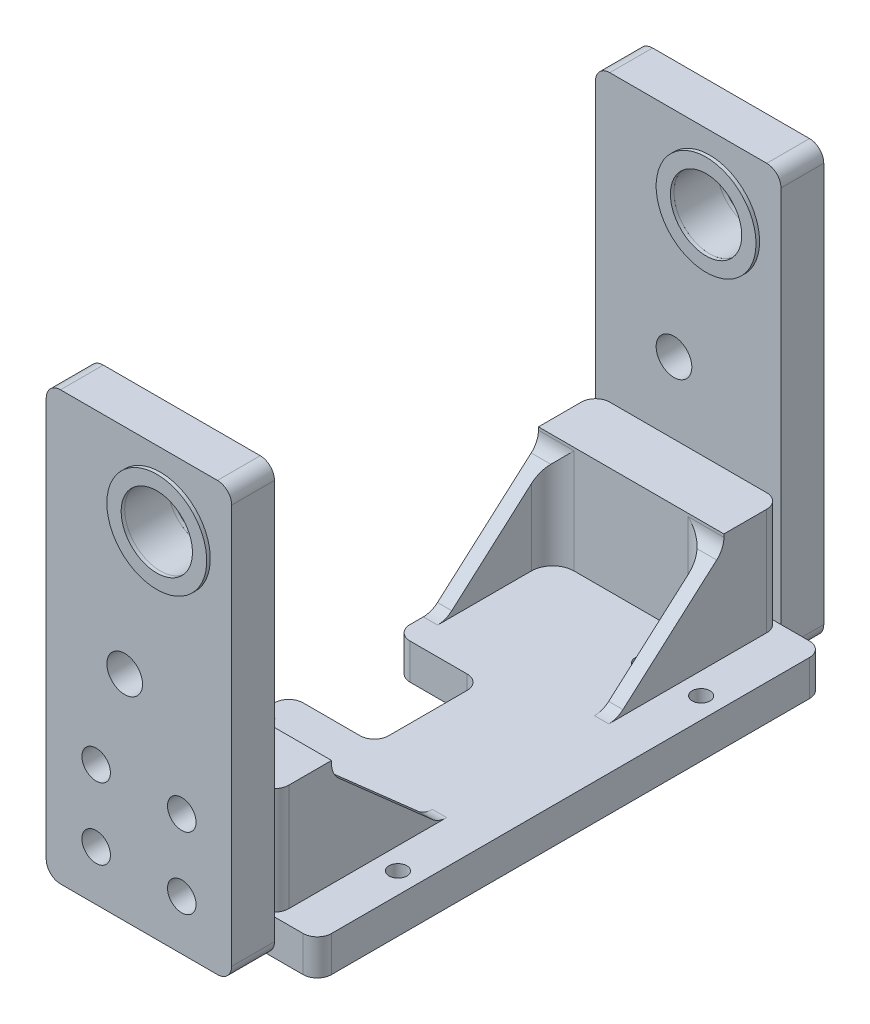
from build123d import *

# Parameters (mm, degrees)
SKETCH_1_W           = 18
SKETCH_1_H           = 21.5
SKETCH_1_R           = 1.25
EXTRUDE_1_DEPTH      = 71
SKETCH_2_W           = 18
SKETCH_2_H           = 59
CUT_EXTRUDE_1_DEPTH  = 42
SKETCH_3_W           = 18
SKETCH_3_H           = 59
EXTRUDE_2_DEPTH      = 7
SKETCH_4_R           = 2.1
CUT_EXTRUDE_2_DEPTH  = 75
SKETCH_5_W           = 12
SKETCH_5_H           = 15
CUT_EXTRUDE_3_DEPTH  = 12
SKETCH_6_R           = 1.65
CUT_EXTRUDE_4_DEPTH  = 10
FILLET_2_R           = 2
FILLET_4_R           = 2
EXTRUDE_3_DEPTH      = 8
SKETCH_9_R           = 1.65
EXTRUDE_4_DEPTH      = 7
SKETCH_10_R          = 1.65
CUT_EXTRUDE_5_DEPTH  = 10
FILLET_5_R           = 2
SKETCH_11_R          = 1.65
EXTRUDE_5_DEPTH      = 20
CUT_EXTRUDE_6_DEPTH  = 22
SKETCH_14_R          = 1.25
SKETCH_14_R_2        = 2.1
EXTRUDE_6_DEPTH      = 6
SKETCH_15_R          = 1.25
SKETCH_15_R_2        = 2.1
EXTRUDE_7_DEPTH      = 6
CUT_EXTRUDE_7_DEPTH  = 21.5
EXTRUDE_8_DEPTH      = 2
EXTRUDE_9_DEPTH      = 2
FILLET_6_R           = 3
CUT_EXTRUDE_8_REACH  = 81.513
SKETCH_20_R          = 1.65
SKETCH_21_W          = 6
SKETCH_21_H          = 3
SKETCH_21_H_2        = 4
SKETCH_21_W_2        = 5
CUT_EXTRUDE_9_DEPTH  = 3
FILLET_7_R           = 1.5
CUT_EXTRUDE_10_DEPTH = 3
SKETCH_23_W          = 26
SKETCH_23_H          = 60
SKETCH_23_R          = 1.65
EXTRUDE_10_DEPTH     = 6
SKETCH_24_R          = 2.5
SKETCH_24_R_2        = 6
CUT_EXTRUDE_11_DEPTH = 6
SKETCH_25_R          = 6
SKETCH_25_R_2        = 5
EXTRUDE_11_DEPTH     = 6
SKETCH_26_R          = 7
SKETCH_26_R_2        = 5
EXTRUDE_12_DEPTH     = 0.5
SKETCH_27_R          = 7
SKETCH_27_R_2        = 5
EXTRUDE_13_DEPTH     = 0.5
FILLET_8_R           = 2
SKETCH_28_R          = 2
CUT_EXTRUDE_12_DEPTH = 6
SKETCH_29_W          = 8
SKETCH_29_H          = 71
EXTRUDE_14_DEPTH     = 5
SKETCH_32_R          = 1.65
EXTRUDE_15_DEPTH     = 5
SKETCH_33_R          = 1.25
CUT_EXTRUDE_13_DEPTH = 10
FILLET_9_R           = 2
CUT_EXTRUDE_14_DEPTH = 15
SKETCH_35_W          = 24
SKETCH_35_H          = 2
EXTRUDE_16_DEPTH     = 15
EXTRUDE_21_DEPTH     = 2
FILLET_10_R          = 3
SKETCH_38_W          = 3.176848992
SKETCH_38_H          = 56.114697213
EXTRUDE_22_DEPTH     = 5
EXTRUDE_23_DEPTH     = 2
FILLET_START         = -27
FILLET_11_DEPTH      = 1.9157
FILLET_START_2       = -25.0843
FILLET_11_2_DEPTH    = 13.173400253
FILLET_START_3       = -7
FILLET_11_3_DEPTH    = 22


with BuildPart() as part:
    # 草图1 → 凸台-拉伸1 (new body)
    with BuildSketch(Plane.XY):
        with Locations((0, -0.75)):
            Rectangle(SKETCH_1_W, SKETCH_1_H)
        with Locations((5.5, -7.5)):
            Circle(SKETCH_1_R, mode=Mode.SUBTRACT)
        with Locations((-5.5, -7.5)):
            Circle(SKETCH_1_R, mode=Mode.SUBTRACT)
        with Locations((-5.5, 7.5)):
            Circle(SKETCH_1_R, mode=Mode.SUBTRACT)
        with Locations((5.5, 7.5)):
            Circle(SKETCH_1_R, mode=Mode.SUBTRACT)
    extrude(amount=EXTRUDE_1_DEPTH)

    # 草图2 → 切除-拉伸1 (cut)
    with BuildSketch(Plane(origin=(0, 10, 0), x_dir=(1, 0, 0), z_dir=(0, 1, 0))):
        with Locations((0, -35.5)):
            Rectangle(SKETCH_2_W, SKETCH_2_H)
    extrude(amount=-CUT_EXTRUDE_1_DEPTH, mode=Mode.SUBTRACT)


with BuildPart() as cut_extrude_1_piece_1:
    # of the separate pieces the step leaves, piece 1, a body of its own (cut_extrude_1_pieces)
    add(part.part.solids().sort_by_distance((9, -11.5, 65))[0])



with BuildPart() as cut_extrude_1_piece_2:
    # of the separate pieces the step leaves, piece 2, a body of its own (cut_extrude_1_pieces)
    add(part.part.solids().sort_by_distance((-9, -11.5, 0))[0])


with BuildPart() as cut_extrude_1_piece_1_1:
    add(cut_extrude_1_piece_1.part)

    add(cut_extrude_1_piece_2.part)  # 凸台-拉伸2 merges 切除-拉伸1 piece 2
    # 草图3 → 凸台-拉伸2 (add)
    with BuildSketch(Plane.XZ.offset(11.5)):
        with Locations((0, 35.5)):
            Rectangle(SKETCH_3_W, SKETCH_3_H)
    extrude(amount=-EXTRUDE_2_DEPTH)

    # 草图4 → 切除-拉伸2 (cut)
    with BuildSketch(Plane.XY.offset(71)):
        with Locations((4, -1.5)):
            Circle(SKETCH_4_R)
    extrude(amount=-CUT_EXTRUDE_2_DEPTH, mode=Mode.SUBTRACT)

    # 草图5 → 切除-拉伸3 (cut)
    with BuildSketch(Plane(origin=(0, -4.5, 0), x_dir=(1, 0, 0), z_dir=(0, 1, 0))):
        with Locations((-3, -35.5)):
            Rectangle(SKETCH_5_W, SKETCH_5_H)
    extrude(amount=-CUT_EXTRUDE_3_DEPTH, mode=Mode.SUBTRACT)

    # 草图6 → 切除-拉伸4 (cut)
    with BuildSketch(Plane(origin=(0, -4.5, 0), x_dir=(1, 0, 0), z_dir=(0, 1, 0))):
        with Locations(Location((4, -14.25, 0), (0, 0, 180))):
            Circle(SKETCH_6_R)
        with Locations(Location((-4, -14.25, 0), (0, 0, 180))):
            Circle(SKETCH_6_R)
        with Locations(Location((-4, -56.75, 0), (0, 0, 180))):
            Circle(SKETCH_6_R)
        with Locations(Location((4, -56.75, 0), (0, 0, 180))):
            Circle(SKETCH_6_R)
    extrude(amount=-CUT_EXTRUDE_4_DEPTH, mode=Mode.SUBTRACT)

    # 圆角2
    fillet_2_edges = [cut_extrude_1_piece_1_1.edges().sort_by_distance(p)[0] for p in [
        (-9, -8, 43),
        (-9, -8, 28),
    ]]
    fillet(fillet_2_edges, radius=FILLET_2_R)

    # 圆角4
    fillet_4_edges = [cut_extrude_1_piece_1_1.edges().sort_by_distance(p)[0] for p in [
        (3, -8, 28),
        (3, -8, 43),
    ]]
    fillet(fillet_4_edges, radius=FILLET_4_R)

    # 草图7 → 凸台-拉伸3 (add)
    with BuildSketch(Plane(origin=(9, 0, 0), x_dir=(0, 0, -1), z_dir=(1, 0, 0))):
        Polygon((0, 10), (-6, 10), (-6, -4.5), (-65, -4.5), (-65, 10), (-71, 10), (-71, -11.5), (0, -11.5), align=None)
    extrude(amount=EXTRUDE_3_DEPTH)

    # 草图9 → 凸台-拉伸4 (add)
    with BuildSketch(Plane(origin=(0, -4.5, 0), x_dir=(1, 0, 0), z_dir=(0, 1, 0))):
        with Locations((-4, -56.75)):
            Circle(SKETCH_9_R)
        with Locations((4, -56.75)):
            Circle(SKETCH_9_R)
        with Locations((4, -14.25)):
            Circle(SKETCH_9_R)
        with Locations((-4, -14.25)):
            Circle(SKETCH_9_R)
    extrude(amount=-EXTRUDE_4_DEPTH)

    # 草图10 → 切除-拉伸5 (cut)
    with BuildSketch(Plane.XZ.offset(11.5)):
        with Locations(Location((12.56, 56.75, 0), (0, 0, 270))):
            Circle(SKETCH_10_R)
        with Locations(Location((4.56, 56.75, 0), (0, 0, 270))):
            Circle(SKETCH_10_R)
        with Locations(Location((12.56, 14.25, 0), (0, 0, 270))):
            Circle(SKETCH_10_R)
        with Locations(Location((4.56, 14.25, 0), (0, 0, 270))):
            Circle(SKETCH_10_R)
    extrude(amount=-CUT_EXTRUDE_5_DEPTH, mode=Mode.SUBTRACT)

    # 圆角5
    fillet_5_edges = [cut_extrude_1_piece_1_1.edges().sort_by_distance(p)[0] for p in [
        (17, -0.75, 0),
        (17, -0.75, 71),
        (-9, -0.75, 0),
        (-9, -0.75, 71),
    ]]
    fillet(fillet_5_edges, radius=FILLET_5_R)

    # 草图11 → 凸台-拉伸5 (add)
    with BuildSketch(Plane.XZ.offset(11.5)):
        with BuildLine():
            Line((15, 71), (-7, 71))
            ThreePointArc((-7, 71), (-8.414213562, 70.414213562), (-9, 69))
            Line((-9, 69), (-9, 45))
            ThreePointArc((-9, 45), (-8.414213562, 43.585786438), (-7, 43))
            Line((-7, 43), (1, 43))
            ThreePointArc((1, 43), (2.414213562, 42.414213562), (3, 41))
            Line((3, 41), (3, 30))
            ThreePointArc((3, 30), (2.414213562, 28.585786438), (1, 28))
            Line((1, 28), (-7, 28))
            ThreePointArc((-7, 28), (-8.414213562, 27.414213562), (-9, 26))
            Line((-9, 26), (-9, 2))
            ThreePointArc((-9, 2), (-8.414213562, 0.585786438), (-7, 0))
            Line((-7, 0), (15, 0))
            ThreePointArc((15, 0), (16.414213562, 0.585786438), (17, 2))
            Line((17, 2), (17, 69))
            ThreePointArc((17, 69), (16.414213562, 70.414213562), (15, 71))
        make_face()
        with Locations(Location((12.56, 56.75, 0), (0, 0, 270))):
            Circle(SKETCH_11_R, mode=Mode.SUBTRACT)
        with Locations(Location((4.56, 14.25, 0), (0, 0, 270))):
            Circle(SKETCH_11_R, mode=Mode.SUBTRACT)
        with Locations(Location((12.56, 14.25, 0), (0, 0, 270))):
            Circle(SKETCH_11_R, mode=Mode.SUBTRACT)
        with Locations(Location((4.56, 56.75, 0), (0, 0, 270))):
            Circle(SKETCH_11_R, mode=Mode.SUBTRACT)
    extrude(amount=EXTRUDE_5_DEPTH)

    # 草图12 → 切除-拉伸6 (cut)
    with BuildSketch(Plane(origin=(0, -4.5, 0), x_dir=(1, 0, 0), z_dir=(0, 1, 0))):
        with BuildLine():
            Line((1, -43), (-7, -43))
            ThreePointArc((-7, -43), (-8.414213562, -43.585786438), (-9, -45))
            Line((-9, -45), (-9, -65))
            Line((-9, -65), (17, -65))
            Line((17, -65), (17, -6))
            Line((17, -6), (-9, -6))
            Line((-9, -6), (-9, -26))
            ThreePointArc((-9, -26), (-8.414213562, -27.414213562), (-7, -28))
            Line((-7, -28), (1, -28))
            ThreePointArc((1, -28), (2.414213562, -28.585786438), (3, -30))
            Line((3, -30), (3, -41))
            ThreePointArc((3, -41), (2.414213562, -42.414213562), (1, -43))
        make_face()
    extrude(amount=-CUT_EXTRUDE_6_DEPTH, mode=Mode.SUBTRACT)

    # 草图14 → 凸台-拉伸6 (add)
    with BuildSketch(Plane.XY.offset(71)):
        with Locations(Location((-5.5, 7.5, 0), (0, 0, 180))):
            Circle(SKETCH_14_R)
        with Locations(Location((5.5, 7.5, 0), (0, 0, 180))):
            Circle(SKETCH_14_R)
        with Locations(Location((-5.5, -7.5, 0), (0, 0, 180))):
            Circle(SKETCH_14_R)
        with Locations(Location((5.5, -7.5, 0), (0, 0, 180))):
            Circle(SKETCH_14_R)
        with Locations(Location((4, -1.5, 0), (0, 0, 180))):
            Circle(SKETCH_14_R_2)
    extrude(amount=-EXTRUDE_6_DEPTH)

    # 草图15 → 凸台-拉伸7 (add)
    with BuildSketch(Plane(origin=(0, 0, 0), x_dir=(-1, 0, 0), z_dir=(0, 0, -1))):
        with Locations((5.5, -7.5)):
            Circle(SKETCH_15_R)
        with Locations((-5.5, 7.5)):
            Circle(SKETCH_15_R)
        with Locations((5.5, 7.5)):
            Circle(SKETCH_15_R)
        with Locations((-5.5, -7.5)):
            Circle(SKETCH_15_R)
        with Locations((-4, -1.5)):
            Circle(SKETCH_15_R_2)
    extrude(amount=-EXTRUDE_7_DEPTH)

    # 草图16 → 切除-拉伸7 (cut)
    with BuildSketch(Plane(origin=(0, 10, 0), x_dir=(1, 0, 0), z_dir=(0, 1, 0))):
        with BuildLine():
            Line((-9, -65), (-9, -69))
            ThreePointArc((-9, -69), (-8.414213562, -70.414213562), (-7, -71))
            Line((-7, -71), (15, -71))
            ThreePointArc((15, -71), (16.414213562, -70.414213562), (17, -69))
            Line((17, -69), (17, -65))
            Line((17, -65), (-9, -65))
        make_face()
        with BuildLine():
            Line((15, 0), (-7, 0))
            ThreePointArc((-7, 0), (-8.414213562, -0.585786438), (-9, -2))
            Line((-9, -2), (-9, -6))
            Line((-9, -6), (17, -6))
            Line((17, -6), (17, -2))
            ThreePointArc((17, -2), (16.414213562, -0.585786438), (15, 0))
        make_face()
    extrude(amount=-CUT_EXTRUDE_7_DEPTH, mode=Mode.SUBTRACT)

    # 草图18 → 凸台-拉伸8 (add)
    with BuildSketch(Plane.ZY.offset(9)):
        Polygon((6, -11.5), (6, -26.5), (23, -26.5), align=None)
        Polygon((48, -26.5), (65, -11.5), (65, -26.5), align=None)
    extrude(amount=-EXTRUDE_8_DEPTH)

    # 草图19 → 凸台-拉伸9 (add)
    with BuildSketch(Plane(origin=(17, 0, 0), x_dir=(0, 0, -1), z_dir=(1, 0, 0))):
        Polygon((-6, -11.5), (-23, -26.5), (-6, -26.5), align=None)
        Polygon((-65, -26.5), (-48, -26.5), (-65, -11.5), align=None)
    extrude(amount=-EXTRUDE_9_DEPTH)

    # 圆角6
    fillet_6_edges = [cut_extrude_1_piece_1_1.edges().sort_by_distance(p)[0] for p in [
        (-8, -26.5, 23),
        (-8, -26.5, 48),
        (15, -19, 6),
        (16, -26.5, 23),
        (15, -19, 65),
        (16, -26.5, 48),
    ]]
    fillet(fillet_6_edges, radius=FILLET_6_R)

    # 切除-拉伸8: up to this face of the body (flat: up to its plane)
    cut_extrude_8_end = Plane(cut_extrude_1_piece_1_1.part.faces().sort_by_distance((4, -21.5, 0))[0])
    # 草图20 → 切除-拉伸8 (cut, up to the picked face)
    with BuildSketch(Plane.XY.offset(71), mode=Mode.PRIVATE) as cut_extrude_8_sk1:
        with Locations((10, -14.5)):
            Circle(SKETCH_20_R)
    cut_extrude_8_tool1 = split(extrude(cut_extrude_8_sk1.sketch, amount=-CUT_EXTRUDE_8_REACH, mode=Mode.PRIVATE), bisect_by=cut_extrude_8_end, keep=Keep.BOTH, mode=Mode.PRIVATE)
    # 草图20 → 切除-拉伸8 (cut, up to the picked face)
    with BuildSketch(Plane.XY.offset(71), mode=Mode.PRIVATE) as cut_extrude_8_sk2:
        with Locations((10, -24.5)):
            Circle(SKETCH_20_R)
    cut_extrude_8_tool2 = split(extrude(cut_extrude_8_sk2.sketch, amount=-CUT_EXTRUDE_8_REACH, mode=Mode.PRIVATE), bisect_by=cut_extrude_8_end, keep=Keep.BOTH, mode=Mode.PRIVATE)
    # 草图20 → 切除-拉伸8 (cut, up to the picked face)
    with BuildSketch(Plane.XY.offset(71), mode=Mode.PRIVATE) as cut_extrude_8_sk3:
        with Locations((-2, -24.5)):
            Circle(SKETCH_20_R)
    cut_extrude_8_tool3 = split(extrude(cut_extrude_8_sk3.sketch, amount=-CUT_EXTRUDE_8_REACH, mode=Mode.PRIVATE), bisect_by=cut_extrude_8_end, keep=Keep.BOTH, mode=Mode.PRIVATE)
    # 草图20 → 切除-拉伸8 (cut, up to the picked face)
    with BuildSketch(Plane.XY.offset(71), mode=Mode.PRIVATE) as cut_extrude_8_sk4:
        with Locations((-2, -14.5)):
            Circle(SKETCH_20_R)
    cut_extrude_8_tool4 = split(extrude(cut_extrude_8_sk4.sketch, amount=-CUT_EXTRUDE_8_REACH, mode=Mode.PRIVATE), bisect_by=cut_extrude_8_end, keep=Keep.BOTH, mode=Mode.PRIVATE)
    add(cut_extrude_8_tool1.solids().sort_by(Axis((10, -14.5, 71), (0, 0, -1)))[0], mode=Mode.SUBTRACT)
    add(cut_extrude_8_tool2.solids().sort_by(Axis((10, -24.5, 71), (0, 0, -1)))[0], mode=Mode.SUBTRACT)
    add(cut_extrude_8_tool3.solids().sort_by(Axis((-2, -24.5, 71), (0, 0, -1)))[0], mode=Mode.SUBTRACT)
    add(cut_extrude_8_tool4.solids().sort_by(Axis((-2, -14.5, 71), (0, 0, -1)))[0], mode=Mode.SUBTRACT)

    # 草图21 → 切除-拉伸9 (cut)
    with BuildSketch(Plane.XY.offset(71)):
        with Locations((4, -16)):
            Rectangle(SKETCH_21_W, SKETCH_21_H)
        with Locations((4, -19.5)):
            Rectangle(SKETCH_21_W, SKETCH_21_H_2)
        with Locations((9.5, -19.5)):
            Rectangle(SKETCH_21_W_2, SKETCH_21_H_2)
        with Locations((4, -23)):
            Rectangle(SKETCH_21_W, SKETCH_21_H)
        with Locations((-1.5, -19.5)):
            Rectangle(SKETCH_21_W_2, SKETCH_21_H_2)
    extrude(amount=-CUT_EXTRUDE_9_DEPTH, mode=Mode.SUBTRACT)

    # 圆角7
    fillet_7_edges = [cut_extrude_1_piece_1_1.edges().sort_by_distance(p)[0] for p in [
        (1, -17.5, 69.5),
        (-4, -17.5, 69.5),
        (-4, -21.5, 69.5),
        (1, -21.5, 69.5),
        (1, -24.5, 69.5),
        (7, -24.5, 69.5),
        (7, -21.5, 69.5),
        (12, -21.5, 69.5),
        (12, -17.5, 69.5),
        (7, -17.5, 69.5),
        (1, -14.5, 69.5),
        (7, -14.5, 69.5),
    ]]
    fillet(fillet_7_edges, radius=FILLET_7_R - 0.0001)  # a hair under: the kernel refuses the full size

    # 草图22 → 切除-拉伸10 (cut)
    with BuildSketch(Plane(origin=(0, 0, 0), x_dir=(-1, 0, 0), z_dir=(0, 0, -1))):
        with BuildLine():
            Line((2.5, -17.5), (0.5, -17.5))
            ThreePointArc((0.5, -17.5), (-0.560660172, -17.060660172), (-1, -16))
            ThreePointArc((-1, -16), (-1.439339828, -14.939339828), (-2.5, -14.5))
            Line((-2.5, -14.5), (-5.5, -14.5))
            ThreePointArc((-5.5, -14.5), (-6.560660172, -14.939339828), (-7, -16))
            ThreePointArc((-7, -16), (-7.439339828, -17.060660172), (-8.5, -17.5))
            Line((-8.5, -17.5), (-10.5, -17.5))
            ThreePointArc((-10.5, -17.5), (-11.560660172, -17.939339828), (-12, -19))
            Line((-12, -19), (-12, -20))
            ThreePointArc((-12, -20), (-11.560660172, -21.060660172), (-10.5, -21.5))
            Line((-10.5, -21.5), (-8.5, -21.5))
            ThreePointArc((-8.5, -21.5), (-7.439339828, -21.939339828), (-7, -23))
            ThreePointArc((-7, -23), (-6.560660172, -24.060660172), (-5.5, -24.5))
            Line((-5.5, -24.5), (-2.5, -24.5))
            ThreePointArc((-2.5, -24.5), (-1.439339828, -24.060660172), (-1, -23))
            ThreePointArc((-1, -23), (-0.560660172, -21.939339828), (0.5, -21.5))
            Line((0.5, -21.5), (2.5, -21.5))
            ThreePointArc((2.5, -21.5), (3.560660172, -21.060660172), (4, -20))
            Line((4, -20), (4, -19))
            ThreePointArc((4, -19), (3.560660172, -17.939339828), (2.5, -17.5))
        make_face()
    extrude(amount=-CUT_EXTRUDE_10_DEPTH, mode=Mode.SUBTRACT)

    # 草图29 → 凸台-拉伸14 (add)
    with BuildSketch(Plane.XZ.offset(31.5)):
        with Locations((19, 35.5)):
            Rectangle(SKETCH_29_W, SKETCH_29_H)
    extrude(amount=-EXTRUDE_14_DEPTH)

    # 草图32 → 凸台-拉伸15 (add)
    with BuildSketch(Plane.XZ.offset(31.5)):
        with Locations((4.56, 14.25)):
            Circle(SKETCH_32_R)
        with Locations((12.56, 14.25)):
            Circle(SKETCH_32_R)
        with Locations((12.56, 56.75)):
            Circle(SKETCH_32_R)
        with Locations((4.56, 56.75)):
            Circle(SKETCH_32_R)
    extrude(amount=-EXTRUDE_15_DEPTH)

    # 草图33 → 切除-拉伸13 (cut)
    with BuildSketch(Plane.XZ.offset(31.5)):
        with Locations(Location((20.06, 56.75, 0), (0, 0, 270))):
            Circle(SKETCH_33_R)
        with Locations(Location((12.06, 56.75, 0), (0, 0, 270))):
            Circle(SKETCH_33_R)
        with Locations(Location((20.06, 14.25, 0), (0, 0, 270))):
            Circle(SKETCH_33_R)
        with Locations(Location((12.06, 14.25, 0), (0, 0, 270))):
            Circle(SKETCH_33_R)
    extrude(amount=-CUT_EXTRUDE_13_DEPTH, mode=Mode.SUBTRACT)

    # 圆角9
    fillet_9_edges = [cut_extrude_1_piece_1_1.edges().sort_by_distance(p)[0] for p in [
        (23, -29, 0),
        (23, -29, 71),
    ]]
    fillet(fillet_9_edges, radius=FILLET_9_R)

    # 草图34 → 切除-拉伸14 (cut)
    with BuildSketch(Plane(origin=(0, -11.5, 0), x_dir=(1, 0, 0), z_dir=(0, 1, 0))):
        with BuildLine():
            Line((15, -22.149448708), (15, -24.13431362))
            Line((15, -24.13431362), (17, -24.13431362))
            Line((17, -24.13431362), (17, -22.149448708))
            Line((17, -22.149448708), (17, -6))
            Line((17, -6), (12, -6))
            ThreePointArc((12, -6), (14.121320344, -6.878679656), (15, -9))
            Line((15, -9), (15, -22.149448708))
        make_face()
        with BuildLine():
            Line((15, -46.86568638), (15, -48.850551292))
            Line((15, -48.850551292), (15, -62))
            ThreePointArc((15, -62), (14.121320344, -64.121320344), (12, -65))
            Line((12, -65), (17, -65))
            Line((17, -65), (17, -48.850551292))
            Line((17, -48.850551292), (17, -46.86568638))
            Line((17, -46.86568638), (15, -46.86568638))
        make_face()
    extrude(amount=-CUT_EXTRUDE_14_DEPTH, mode=Mode.SUBTRACT)

    # 草图35 → 凸台-拉伸16 (add)
    with BuildSketch(Plane(origin=(0, -11.5, 0), x_dir=(1, 0, 0), z_dir=(0, 1, 0))):
        with Locations((5, -7)):
            Rectangle(SKETCH_35_W, SKETCH_35_H)
        with Locations((5, -64)):
            Rectangle(SKETCH_35_W, SKETCH_35_H)
    extrude(amount=-EXTRUDE_16_DEPTH)

    # 草图37 → 凸台-拉伸21 (add)
    with BuildSketch(Plane.ZY.offset(7)):
        Polygon((63, -11.5), (63, -13.264705882), (65, -11.5), align=None)
        Polygon((8, -11.5), (6, -11.5), (8, -13.264705882), align=None)
    extrude(amount=EXTRUDE_21_DEPTH)

    # 圆角10
    fillet_10_edges = [cut_extrude_1_piece_1_1.edges().sort_by_distance(p)[0] for p in [
        (-8, -13.264705882, 63),
        (-8, -13.264705882, 8),
    ]]
    fillet(fillet_10_edges, radius=FILLET_10_R)

    # 草图38 → 凸台-拉伸22 (add)
    with BuildSketch(Plane(origin=(0, -26.5, 0), x_dir=(1, 0, 0), z_dir=(0, 1, 0))):
        with Locations((8.82334155, -34.984064712)):
            Rectangle(SKETCH_38_W, SKETCH_38_H)
    extrude(amount=-EXTRUDE_22_DEPTH)

    # 草图39 → 凸台-拉伸23 (add)
    with BuildSketch(Plane(origin=(17, 0, 0), x_dir=(0, 0, -1), z_dir=(1, 0, 0))):
        with BuildLine():
            Line((-48.850551292, -25.749513566), (-61.984864911, -14.160413314))
            ThreePointArc((-61.984864911, -14.160413314), (-62.734464731, -13.144878124), (-63, -11.910899747))
            Line((-63, -11.910899747), (-63, -26.5))
            Line((-63, -26.5), (-46.86568638, -26.5))
            ThreePointArc((-46.86568638, -26.5), (-47.926690457, -26.306113032), (-48.850551292, -25.749513566))
        make_face()
        with BuildLine():
            Line((-24.13431362, -26.5), (-8, -26.5))
            Line((-8, -26.5), (-8, -11.910899747))
            ThreePointArc((-8, -11.910899747), (-8.265535269, -13.144878124), (-9.015135089, -14.160413314))
            Line((-9.015135089, -14.160413314), (-22.149448708, -25.749513566))
            ThreePointArc((-22.149448708, -25.749513566), (-23.073309543, -26.306113032), (-24.13431362, -26.5))
        make_face()
    extrude(amount=-EXTRUDE_23_DEPTH)

    # 圆角11: read off the stored shape, not the designer's step
    # 圆角11 outline → 圆角11 (add)
    with BuildSketch(Plane(origin=(0, 0, 0), x_dir=(1, 0, 0), z_dir=(0, 1, 0)).offset(FILLET_START)):
        with BuildLine():
            ThreePointArc((-7, -11), (-6.121320344, -8.878679656), (-4, -8))
            Line((-4, -8), (-7, -8))
            Line((-7, -8), (-7, -11))
        make_face()
        with BuildLine():
            ThreePointArc((12, -8), (14.121320344, -8.878679656), (15, -11))
            Line((15, -11), (15, -8))
            Line((15, -8), (12, -8))
        make_face()
        with BuildLine():
            ThreePointArc((15, -60), (14.121320344, -62.121320344), (12, -63))
            Line((12, -63), (15, -63))
            Line((15, -63), (15, -60))
        make_face()
        with BuildLine():
            ThreePointArc((-4, -63), (-6.121320344, -62.121320344), (-7, -60))
            Line((-7, -60), (-7, -63))
            Line((-7, -63), (-4, -63))
        make_face()
    extrude(amount=FILLET_11_DEPTH)

    # Fillet 11 2 outline → Fillet 11 2 (add)
    with BuildSketch(Plane(origin=(0, 0, 0), x_dir=(1, 0, 0), z_dir=(0, 1, 0)).offset(FILLET_START_2)):
        with BuildLine():
            ThreePointArc((-7, -11), (-6.121320344, -8.878679656), (-4, -8))
            Line((-4, -8), (-7, -8))
            Line((-7, -8), (-7, -11))
        make_face()
        with BuildLine():
            ThreePointArc((12, -8), (14.121320344, -8.878679656), (15, -11))
            Line((15, -11), (15, -8))
            Line((15, -8), (12, -8))
        make_face()
        with BuildLine():
            ThreePointArc((15, -60), (14.121320344, -62.121320344), (12, -63))
            Line((12, -63), (15, -63))
            Line((15, -63), (15, -60))
        make_face()
        with BuildLine():
            ThreePointArc((-4, -63), (-6.121320344, -62.121320344), (-7, -60))
            Line((-7, -60), (-7, -63))
            Line((-7, -63), (-4, -63))
        make_face()
    extrude(amount=FILLET_11_2_DEPTH)

    # Fillet 11 3 outline → Fillet 11 3 (cut)
    with BuildSketch(Plane.YZ.offset(FILLET_START_3)):
        with BuildLine():
            Line((-11.910899747, 11), (-15.911764706, 11))
            Line((-15.911764706, 11), (-14.160413314, 9.015135089))
            ThreePointArc((-14.160413314, 9.015135089), (-13.144878124, 8.265535269), (-11.910899747, 8))
            Line((-11.910899747, 8), (-11.910899747, 11))
        make_face()
        with BuildLine():
            Line((-11.910899747, 60), (-11.910899747, 63))
            ThreePointArc((-11.910899747, 63), (-13.144878124, 62.734464731), (-14.160413314, 61.984864911))
            Line((-14.160413314, 61.984864911), (-15.911764706, 60))
            Line((-15.911764706, 60), (-11.910899747, 60))
        make_face()
    extrude(amount=FILLET_11_3_DEPTH, mode=Mode.SUBTRACT)


with BuildPart() as body_2:
    # 草图23 → 凸台-拉伸10 (new body)
    with BuildSketch(Plane(origin=(0, 0, 0), x_dir=(-1, 0, 0), z_dir=(0, 0, -1))):
        with Locations((-4, -1.5)):
            Rectangle(SKETCH_23_W, SKETCH_23_H)
        with Locations((-10, -24.5)):
            Circle(SKETCH_23_R, mode=Mode.SUBTRACT)
        with Locations((2, -24.5)):
            Circle(SKETCH_23_R, mode=Mode.SUBTRACT)
        with Locations((2, -14.5)):
            Circle(SKETCH_23_R, mode=Mode.SUBTRACT)
        with Locations((-10, -14.5)):
            Circle(SKETCH_23_R, mode=Mode.SUBTRACT)
    extrude(amount=EXTRUDE_10_DEPTH)

    # 草图24 → 切除-拉伸11 (cut)
    with BuildSketch(Plane(origin=(0, 0, -6), x_dir=(-1, 0, 0), z_dir=(0, 0, -1))):
        with Locations((-2, -1.5)):
            Circle(SKETCH_24_R)
        with Locations((-7, 18.5)):
            Circle(SKETCH_24_R_2)
    extrude(amount=-CUT_EXTRUDE_11_DEPTH, mode=Mode.SUBTRACT)

    # 圆角8
    fillet_8_edges = [body_2.edges().sort_by_distance(p)[0] for p in [
        (17, 28.5, -3),
        (-9, 28.5, -3),
        (-9, -31.5, -3),
        (17, -31.5, -3),
    ]]
    fillet(fillet_8_edges, radius=FILLET_8_R)

    # 草图28 → 切除-拉伸12 (cut)
    with BuildSketch(Plane(origin=(0, 0, -6), x_dir=(-1, 0, 0), z_dir=(0, 0, -1))):
        with Locations((2, -14.5)):
            Circle(SKETCH_28_R)
        with Locations((2, -24.5)):
            Circle(SKETCH_28_R)
        with Locations((-10, -24.5)):
            Circle(SKETCH_28_R)
        with Locations((-10, -14.5)):
            Circle(SKETCH_28_R)
    extrude(amount=-CUT_EXTRUDE_12_DEPTH, mode=Mode.SUBTRACT)


with BuildPart() as body_3:
    # 草图25 → 凸台-拉伸11 (new body)
    with BuildSketch(Plane(origin=(0, 0, -6), x_dir=(-1, 0, 0), z_dir=(0, 0, -1))):
        with Locations((-7, 18.5)):
            Circle(SKETCH_25_R)
        with Locations((-7, 18.5)):
            Circle(SKETCH_25_R_2, mode=Mode.SUBTRACT)
    extrude(amount=-EXTRUDE_11_DEPTH)


with BuildPart() as body_4:
    # 草图26 → 凸台-拉伸12 (new body)
    with BuildSketch(Plane(origin=(0, 0, -6), x_dir=(-1, 0, 0), z_dir=(0, 0, -1))):
        with Locations((-7, 18.5)):
            Circle(SKETCH_26_R)
        with Locations((-7, 18.5)):
            Circle(SKETCH_26_R_2, mode=Mode.SUBTRACT)
    extrude(amount=EXTRUDE_12_DEPTH)


with BuildPart() as body_5:
    # 草图27 → 凸台-拉伸13 (new body)
    with BuildSketch(Plane.XY):
        with Locations((7, 18.5)):
            Circle(SKETCH_27_R)
        with Locations((7, 18.5)):
            Circle(SKETCH_27_R_2, mode=Mode.SUBTRACT)
    extrude(amount=EXTRUDE_13_DEPTH)


with BuildPart() as body_6:
    # 镜向1: mirrored copy
    add(body_2.part.mirror(Plane.XY.offset(35.5)))


with BuildPart() as body_7:
    # Mirror 1 2: mirrored copy
    add(body_3.part.mirror(Plane.XY.offset(35.5)))


with BuildPart() as body_8:
    # Mirror 1 3: mirrored copy
    add(body_4.part.mirror(Plane.XY.offset(35.5)))


with BuildPart() as body_9:
    # Mirror 1 4: mirrored copy
    add(body_5.part.mirror(Plane.XY.offset(35.5)))


solid = Compound([cut_extrude_1_piece_1_1.part, body_2.part, body_3.part, body_4.part, body_5.part, body_6.part, body_7.part, body_8.part, body_9.part])
